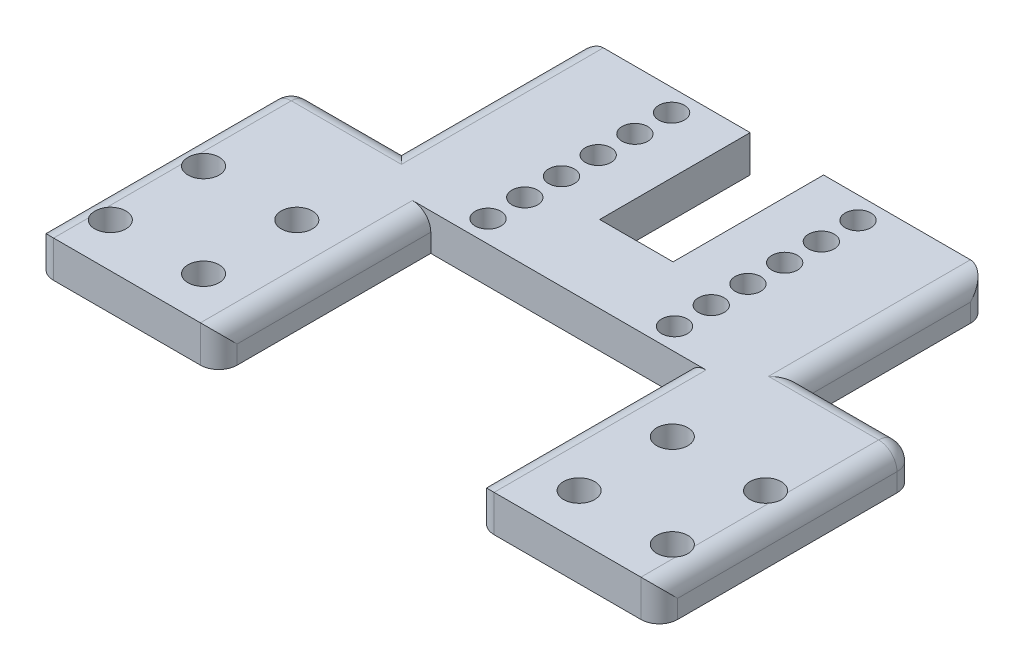
from build123d import *

# Parameters (mm, degrees)
BOSS_EXTRUDE1_DEPTH  = 10
SKETCH2_R            = 4.25
CUT_EXTRUDE1_DEPTH   = 10
SKETCH3_R            = 3.5
CUT_EXTRUDE2_DEPTH   = 10
LPATTERN1_COUNT      = 2
LPATTERN1_PITCH      = 50.8
LPATTERN1_COUNT_DIR2 = 6
LPATTERN1_PITCH_DIR2 = 10
SKETCH4_W            = 30
SKETCH4_H            = 50
CUT_EXTRUDE3_DEPTH   = 10
FILLET1_R            = 5
SKETCH5_W            = 20
SKETCH5_H            = 41
CUT_EXTRUDE4_DEPTH   = 10


with BuildPart() as part:
    # Sketch1 → Boss-Extrude1 (new body)
    with BuildSketch(Plane(origin=(0, 0, 0), x_dir=(1, 0, 0), z_dir=(0, 1, 0))):
        Polygon((0, 0), (50, 0), (120, 0), (170, 0), (170, -119.75), (120, -119.75), (120, -62), (50, -62), (50, -119.75), (0, -119.75), align=None)
    extrude(amount=BOSS_EXTRUDE1_DEPTH)

    # Sketch2 → Cut-Extrude1 (cut)
    with BuildSketch(Plane(origin=(0, 10, 0), x_dir=(1, 0, 0), z_dir=(0, 1, 0))):
        with Locations(Location((33.85, -82.35, 0), (0, 0, 270))):
            Circle(SKETCH2_R)
        with Locations(Location((8.45, -82.35, 0), (0, 0, 270))):
            Circle(SKETCH2_R)
        with Locations(Location((33.85, -107.75, 0), (0, 0, 270))):
            Circle(SKETCH2_R)
        with Locations(Location((8.45, -107.75, 0), (0, 0, 270))):
            Circle(SKETCH2_R)
        with Locations(Location((161.55, -107.75, 0), (0, 0, 270))):
            Circle(SKETCH2_R)
        with Locations(Location((136.15, -107.75, 0), (0, 0, 270))):
            Circle(SKETCH2_R)
        with Locations(Location((136.15, -82.35, 0), (0, 0, 270))):
            Circle(SKETCH2_R)
        with Locations(Location((161.55, -82.35, 0), (0, 0, 270))):
            Circle(SKETCH2_R)
    extrude(amount=-CUT_EXTRUDE1_DEPTH, mode=Mode.SUBTRACT)

    # Sketch3 → Cut-Extrude2 (cut)
    with BuildSketch(Plane(origin=(0, 10, 0), x_dir=(1, 0, 0), z_dir=(0, 1, 0))):
        with Locations(Location((59.6, -6, 0), (0, 0, 270))):
            Circle(SKETCH3_R)
    cut_extrude2 = extrude(amount=-CUT_EXTRUDE2_DEPTH, mode=Mode.SUBTRACT)

    # LPattern1: Cut-Extrude2 2 × 6
    with Locations(*[(i * LPATTERN1_PITCH, 0, j * LPATTERN1_PITCH_DIR2) for i in range(LPATTERN1_COUNT) for j in range(LPATTERN1_COUNT_DIR2) if (i, j) != (0, 0)]):
        add(cut_extrude2, mode=Mode.SUBTRACT)

    # Sketch4 → Cut-Extrude3 (cut)
    with BuildSketch(Plane(origin=(0, 10, 0), x_dir=(1, 0, 0), z_dir=(0, 1, 0))):
        with Locations((15, -25)):
            Rectangle(SKETCH4_W, SKETCH4_H)
        with Locations((155, -25)):
            Rectangle(SKETCH4_W, SKETCH4_H)
    extrude(amount=-CUT_EXTRUDE3_DEPTH, mode=Mode.SUBTRACT)

    # Fillet1
    # the kernel refuses this fillet: 5 mm, written as the material it takes off along each edge
    with BuildSketch(Plane(origin=(5, 5, 55), x_dir=(0, 0, -1), z_dir=(0, 1, 0))) as fillet1_piece_1_section:
        Polygon((0, 0), (FILLET1_R, 0), (FILLET1_R, FILLET1_R), (0, FILLET1_R), align=None)
    fillet1_piece_1 = extrude(amount=FILLET1_R, mode=Mode.PRIVATE)
    fillet1_piece_1 = fillet1_piece_1 - Plane(origin=(5, 5, 55), x_dir=(0.7071067811865476, 0, 0.7071067811865475), z_dir=(0, 1, 0)) * Sphere(FILLET1_R, mode=Mode.PRIVATE)
    add(fillet1_piece_1, mode=Mode.SUBTRACT)
    with BuildSketch(Plane(origin=(165, 5, 55), x_dir=(1, 0, 0), z_dir=(0, 1, 0))) as fillet1_piece_2_section:
        Polygon((0, 0), (FILLET1_R, 0), (FILLET1_R, FILLET1_R), (0, FILLET1_R), align=None)
    fillet1_piece_2 = extrude(amount=FILLET1_R, mode=Mode.PRIVATE)
    fillet1_piece_2 = fillet1_piece_2 - Plane(origin=(165, 5, 55), x_dir=(-0.7071067811865475, 0, 0.7071067811865476), z_dir=(0, 1, 0)) * Sphere(FILLET1_R, mode=Mode.PRIVATE)
    add(fillet1_piece_2, mode=Mode.SUBTRACT)
    with BuildSketch(Plane(origin=(0, 10, 132.25), x_dir=(1, 0, 0), z_dir=(0, 0, -1)), Plane(origin=(170, 10, 55), x_dir=(-1, 0, 0), z_dir=(0, 0, 1))) as fillet1_piece_3:
        with BuildLine():
            CenterArc((FILLET1_R, FILLET1_R), FILLET1_R, 180, 90)
            Line((0, FILLET1_R), (0, 0))
            Line((0, 0), (FILLET1_R, 0))
        make_face()
    extrude(amount=77.25, mode=Mode.SUBTRACT)
    with BuildSketch(Plane(origin=(0, 5, 50), x_dir=(1, 0, 0), z_dir=(0, -1, 0)), Plane(origin=(170, 5, 50), x_dir=(0, 0, 1), z_dir=(0, -1, 0))) as fillet1_piece_4:
        with BuildLine():
            CenterArc((FILLET1_R, FILLET1_R), FILLET1_R, 180, 90)
            Line((0, FILLET1_R), (0, 0))
            Line((0, 0), (FILLET1_R, 0))
        make_face()
    extrude(amount=17.5, mode=Mode.SUBTRACT)
    with BuildSketch(Plane(origin=(30, 22.5, 0), x_dir=(1, 0, 0), z_dir=(0, -1, 0))) as fillet1_piece_5:
        with BuildLine():
            CenterArc((FILLET1_R, FILLET1_R), FILLET1_R, 180, 90)
            Line((0, FILLET1_R), (0, 0))
            Line((0, 0), (FILLET1_R, 0))
        make_face()
    extrude(amount=35, mode=Mode.SUBTRACT)
    with BuildSketch(Plane(origin=(30, 10, 50), x_dir=(0, 0, 1), z_dir=(-1, 0, 0))) as fillet1_piece_6:
        with BuildLine():
            CenterArc((FILLET1_R, -FILLET1_R), FILLET1_R, 90, 90)
            Line((0, -FILLET1_R), (0, 0))
            Line((0, 0), (FILLET1_R, 0))
        make_face()
    extrude(amount=25, mode=Mode.SUBTRACT)
    with BuildSketch(Plane(origin=(30, 10, -12.5), x_dir=(1, 0, 0), z_dir=(0, 0, 1)), Plane(origin=(140, 10, -12.5), x_dir=(0, -1, 0), z_dir=(0, 0, 1))) as fillet1_piece_7:
        with BuildLine():
            CenterArc((FILLET1_R, -FILLET1_R), FILLET1_R, 90, 90)
            Line((0, -FILLET1_R), (0, 0))
            Line((0, 0), (FILLET1_R, 0))
        make_face()
    extrude(amount=62.5, mode=Mode.SUBTRACT)
    with BuildSketch(Plane(origin=(140, 22.5, 0), x_dir=(-1, 0, 0), z_dir=(0, -1, 0)), Plane(origin=(170, -12.5, 119.75), x_dir=(-1, 0, 0), z_dir=(0, 1, 0)), Plane(origin=(120, -12.5, 119.75), x_dir=(0, 0, -1), z_dir=(0, 1, 0)), Plane(origin=(50, -12.5, 119.75), x_dir=(-1, 0, 0), z_dir=(0, 1, 0)), Plane(origin=(0, -12.5, 119.75), x_dir=(0, 0, -1), z_dir=(0, 1, 0))) as fillet1_piece_8:
        with BuildLine():
            CenterArc((FILLET1_R, -FILLET1_R), FILLET1_R, 90, 90)
            Line((0, -FILLET1_R), (0, 0))
            Line((0, 0), (FILLET1_R, 0))
        make_face()
    extrude(amount=35, mode=Mode.SUBTRACT)
    with BuildSketch(Plane(origin=(140, 10, 50), x_dir=(0, 0, 1), z_dir=(1, 0, 0))) as fillet1_piece_9:
        with BuildLine():
            CenterArc((FILLET1_R, FILLET1_R), FILLET1_R, 180, 90)
            Line((0, FILLET1_R), (0, 0))
            Line((0, 0), (FILLET1_R, 0))
        make_face()
    extrude(amount=25, mode=Mode.SUBTRACT)
    with BuildSketch(Plane(origin=(50, 10, 62), x_dir=(-1, 0, 0), z_dir=(0, 0, 1)), Plane(origin=(120, 10, 132.25), x_dir=(1, 0, 0), z_dir=(0, 0, -1))) as fillet1_piece_10:
        with BuildLine():
            CenterArc((FILLET1_R, FILLET1_R), FILLET1_R, 180, 90)
            Line((0, FILLET1_R), (0, 0))
            Line((0, 0), (FILLET1_R, 0))
        make_face()
    extrude(amount=70.25, mode=Mode.SUBTRACT)
    with BuildSketch(Plane(origin=(30, 10, -12.5), x_dir=(1, 0, 0), z_dir=(0, 0, 1))) as fillet1_piece_11a_section:
        with BuildLine():
            CenterArc((FILLET1_R, -FILLET1_R), FILLET1_R, 90, 90)
            Line((0, -FILLET1_R), (0, 0))
            Line((0, 0), (FILLET1_R, 0))
        make_face()
    fillet1_piece_11a = extrude(amount=75, mode=Mode.PRIVATE)
    fillet1_piece_11a = split(fillet1_piece_11a, bisect_by=Plane(origin=(31.131975571, 8.868024429, 50), z_dir=(0, 0, 1)), keep=Keep.TOP, mode=Mode.PRIVATE)
    with BuildSketch(Plane(origin=(42.5, 10, 50), x_dir=(0, 0, 1), z_dir=(-1, 0, 0))) as fillet1_piece_11b_section:
        with BuildLine():
            CenterArc((FILLET1_R, -FILLET1_R), FILLET1_R, 90, 90)
            Line((0, -FILLET1_R), (0, 0))
            Line((0, 0), (FILLET1_R, 0))
        make_face()
    fillet1_piece_11b = extrude(amount=37.5, mode=Mode.PRIVATE)
    fillet1_piece_11b = split(fillet1_piece_11b, bisect_by=Plane(origin=(30, 8.868024429, 51.131975571), z_dir=(1, 0, 0)), keep=Keep.TOP, mode=Mode.PRIVATE)
    fillet1_piece_11 = fillet1_piece_11a & fillet1_piece_11b
    add(fillet1_piece_11, mode=Mode.SUBTRACT)
    with BuildSketch(Plane(origin=(140, 10, -12.5), x_dir=(0, -1, 0), z_dir=(0, 0, 1))) as fillet1_piece_12a_section:
        with BuildLine():
            CenterArc((FILLET1_R, -FILLET1_R), FILLET1_R, 90, 90)
            Line((0, -FILLET1_R), (0, 0))
            Line((0, 0), (FILLET1_R, 0))
        make_face()
    fillet1_piece_12a = extrude(amount=75, mode=Mode.PRIVATE)
    fillet1_piece_12a = split(fillet1_piece_12a, bisect_by=Plane(origin=(138.868024429, 8.868024429, 50), z_dir=(0, 0, 1)), keep=Keep.TOP, mode=Mode.PRIVATE)
    with BuildSketch(Plane(origin=(127.5, 10, 50), x_dir=(0, 0, 1), z_dir=(1, 0, 0))) as fillet1_piece_12b_section:
        with BuildLine():
            CenterArc((FILLET1_R, FILLET1_R), FILLET1_R, 180, 90)
            Line((0, FILLET1_R), (0, 0))
            Line((0, 0), (FILLET1_R, 0))
        make_face()
    fillet1_piece_12b = extrude(amount=37.5, mode=Mode.PRIVATE)
    fillet1_piece_12b = split(fillet1_piece_12b, bisect_by=Plane(origin=(140, 8.868024429, 51.131975571), z_dir=(-1, 0, 0)), keep=Keep.TOP, mode=Mode.PRIVATE)
    fillet1_piece_12 = fillet1_piece_12a & fillet1_piece_12b
    add(fillet1_piece_12, mode=Mode.SUBTRACT)

    # Sketch5 → Cut-Extrude4 (cut)
    with BuildSketch(Plane(origin=(0, 10, 0), x_dir=(1, 0, 0), z_dir=(0, 1, 0))):
        with Locations((85, -20.5)):
            Rectangle(SKETCH5_W, SKETCH5_H)
    extrude(amount=-CUT_EXTRUDE4_DEPTH, mode=Mode.SUBTRACT)


solid = part.part
